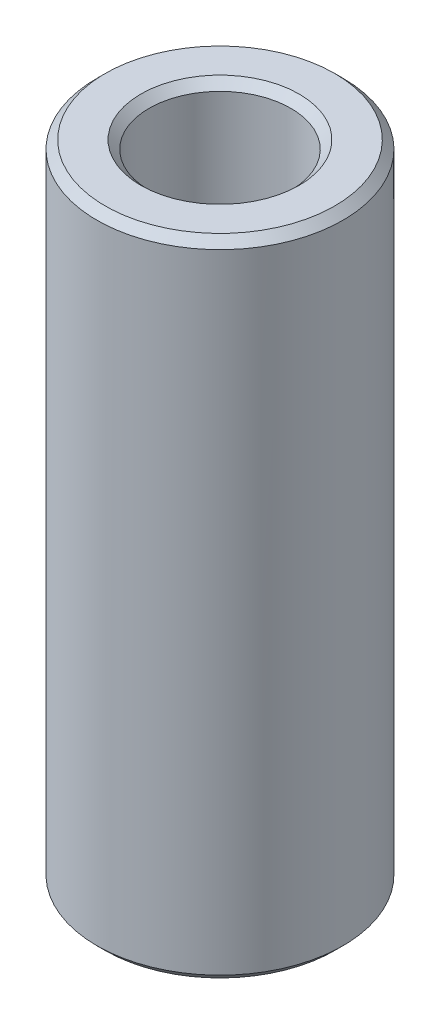
from build123d import *

# Parameters (mm, degrees)
SKETCH1_R           = 40
BOSS_EXTRUDE1_DEPTH = 209.644705536
SKETCH2_R           = 23.059697106
CUT_EXTRUDE1_DEPTH  = 218.14258578
CHAMFER1_SIZE       = 2.680415069


with BuildPart() as part:
    # Sketch1 → Boss-Extrude1 (new body)
    with BuildSketch(Plane(origin=(0, 0, 0), x_dir=(1, 0, 0), z_dir=(0, 1, 0))):
        Circle(SKETCH1_R)
    extrude(amount=BOSS_EXTRUDE1_DEPTH)

    # Sketch2 → Cut-Extrude1 (cut, through all)
    with BuildSketch(Plane(origin=(0, 0, 0), x_dir=(1, 0, 0), z_dir=(0, 1, 0))):
        Circle(SKETCH2_R)
    extrude(amount=CUT_EXTRUDE1_DEPTH, mode=Mode.SUBTRACT)

    # Chamfer1
    chamfer1_edges = [part.edges().sort_by_distance(p)[0] for p in [
        (-23.059697106, 209.644705536, 0),
        (-23.059697106, 0, 0),
        (-40, 0, 0),
        (-40, 209.644705536, 0),
    ]]
    chamfer(chamfer1_edges, length=CHAMFER1_SIZE)


solid = part.part
